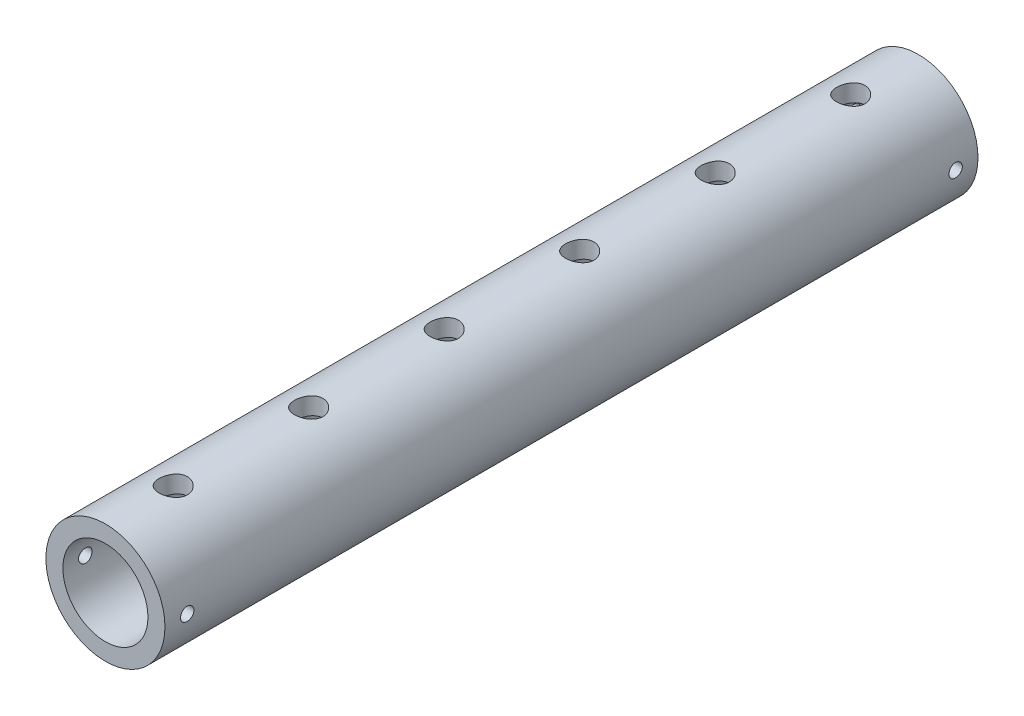
from build123d import *

# Parameters (mm, degrees)
SKETCH2_R               = 13.335
SKETCH2_R_2             = 9.525
BOSS_EXTRUDE1_DEPTH     = 182.118
CUT_EXTRUDE1_START      = -13.335000102
CUT_EXTRUDE1_OUTLINE_R  = 3.175
CUT_EXTRUDE1_DEPTH      = 26.670000204
CUT_EXTRUDE2_DEPTH      = 184.091808707
CUT_EXTRUDE2_DEPTH_BACK = 184.091808707
SKETCH5_R               = 1.5


# Read off the part's stored shape, not the designer's step: Cut-Extrude1
with BuildPart() as part:
    # Sketch2 → Boss-Extrude1 (new body)
    with BuildSketch(Plane.XY):
        Circle(SKETCH2_R)
        Circle(SKETCH2_R_2, mode=Mode.SUBTRACT)
    extrude(amount=BOSS_EXTRUDE1_DEPTH)

    # Cut-Extrude1 outline → Cut-Extrude1 (cut)
    with BuildSketch(Plane(origin=(0, 0, 0), x_dir=(1, 0, 0), z_dir=(0, 1, 0)).offset(CUT_EXTRUDE1_START)):
        with Locations((0, -136.5885)):
            Circle(CUT_EXTRUDE1_OUTLINE_R)
        with Locations((0, -45.5295)):
            Circle(CUT_EXTRUDE1_OUTLINE_R)
        with Locations((0, -75.8825)):
            Circle(CUT_EXTRUDE1_OUTLINE_R)
        with Locations((0, -106.2355)):
            Circle(CUT_EXTRUDE1_OUTLINE_R)
        with Locations((0, -15.1765)):
            Circle(CUT_EXTRUDE1_OUTLINE_R)
        with Locations((0, -166.9415)):
            Circle(CUT_EXTRUDE1_OUTLINE_R)
    extrude(amount=CUT_EXTRUDE1_DEPTH, mode=Mode.SUBTRACT)

    # Sketch5 → Cut-Extrude2 (cut, two sides: drawn at the far end of the back side and taken through both)
    with BuildSketch(Plane(origin=(0, 0, 0), x_dir=(0, 0, -1), z_dir=(1, 0, 0)).offset(-CUT_EXTRUDE2_DEPTH_BACK)):
        with Locations((-177.118, 0)):
            Circle(SKETCH5_R)
        with Locations((-5, 0)):
            Circle(SKETCH5_R)
    extrude(amount=CUT_EXTRUDE2_DEPTH + CUT_EXTRUDE2_DEPTH_BACK, mode=Mode.SUBTRACT)


solid = part.part
